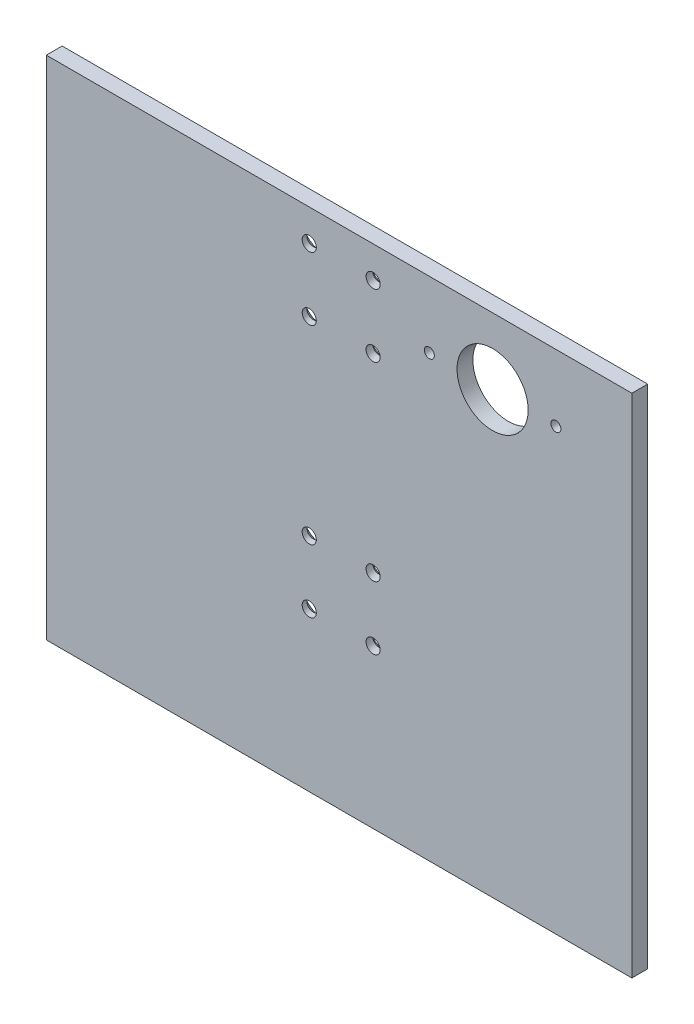
from build123d import *

# Parameters (mm, degrees)
SKETCH1_W                                          = 234.95
SKETCH1_H                                          = 203.2
BOSS_EXTRUDE1_DEPTH                                = 6.35
SKETCH2_R                                          = 14.2748
CUT_EXTRUDE1_DEPTH                                 = 156.445354144
CSK_FOR_10_FLAT_HEAD_MACHINE_SCREW_100_D           = 5.6134
CSK_FOR_10_FLAT_HEAD_MACHINE_SCREW_100_CSINK_D     = 17.78
CSK_FOR_10_FLAT_HEAD_MACHINE_SCREW_100_CSINK_ANGLE = 90
CSK_FOR_10_FLAT_HEAD_MACHINE_SCREW_2_D             = 5.6134
CSK_FOR_10_FLAT_HEAD_MACHINE_SCREW_2_CSINK_D       = 17.78
CSK_FOR_10_FLAT_HEAD_MACHINE_SCREW_2_CSINK_ANGLE   = 90
CUT_EXTRUDE2_DEPTH                                 = 156.445354144


with BuildPart() as part:
    # Sketch1 → Boss-Extrude1 (new body)
    with BuildSketch(Plane.XY):
        Rectangle(SKETCH1_W, SKETCH1_H)
    extrude(amount=BOSS_EXTRUDE1_DEPTH)

    # Sketch2 → Cut-Extrude1 (cut, through all)
    with BuildSketch(Plane.XY.offset(6.35)):
        with Locations((61.595, 74.93)):
            Circle(SKETCH2_R)
    extrude(amount=-CUT_EXTRUDE1_DEPTH, mode=Mode.SUBTRACT)

    # CSK for _10 Flat Head Machine Screw _100 (through all)
    with Locations(Plane(origin=(292.076985897, -265.595089466, -43.80037576), x_dir=(0.9908610866457157, 0, -0.1348862742137668), z_dir=(-0.1348862742137668, 0, -0.9908610866457157))):
        with Locations((-308.041854918, -227.495089466), (-308.041854918, -252.895089466), (-308.041972913, -329.095089466), (-308.041972913, -354.495089466)):
            CounterSinkHole(CSK_FOR_10_FLAT_HEAD_MACHINE_SCREW_100_D / 2, CSK_FOR_10_FLAT_HEAD_MACHINE_SCREW_100_CSINK_D / 2, counter_sink_angle=CSK_FOR_10_FLAT_HEAD_MACHINE_SCREW_100_CSINK_ANGLE)

    # CSK for _10 Flat Head Machine Screw  2 (through all)
    with Locations(Plane(origin=(292.419597033, -265.595089466, -41.283588599), x_dir=(0.9908610866457157, 0, -0.13488627421376656), z_dir=(-0.13488627421376656, 0, -0.9908610866457157))):
        with Locations((-282.641854918, -227.495089466), (-282.641854918, -252.895089466), (-282.641972913, -329.095089466), (-282.641972913, -354.495089466)):
            CounterSinkHole(CSK_FOR_10_FLAT_HEAD_MACHINE_SCREW_2_D / 2, CSK_FOR_10_FLAT_HEAD_MACHINE_SCREW_2_CSINK_D / 2, counter_sink_angle=CSK_FOR_10_FLAT_HEAD_MACHINE_SCREW_2_CSINK_ANGLE)

    # Sketch10 → Cut-Extrude2 (cut, through all)
    with BuildSketch(Plane(origin=(0, 0, 0), x_dir=(-1, 0, 0), z_dir=(0, 0, -1))):
        with BuildLine():
            ThreePointArc((-36.190611119, 72.966686968), (-34.175766597, 74.990432638), (-36.199512267, 77.005277159))
            ThreePointArc((-36.199512267, 77.005277159), (-38.214356788, 74.98153149), (-36.190611119, 72.966686968))
        make_face()
        with BuildLine():
            ThreePointArc((-86.990487733, 72.854722841), (-84.975643212, 74.87846851), (-86.999388881, 76.893313032))
            ThreePointArc((-86.999388881, 76.893313032), (-89.014233403, 74.869567362), (-86.990487733, 72.854722841))
        make_face()
    extrude(amount=-CUT_EXTRUDE2_DEPTH, mode=Mode.SUBTRACT)


solid = part.part
